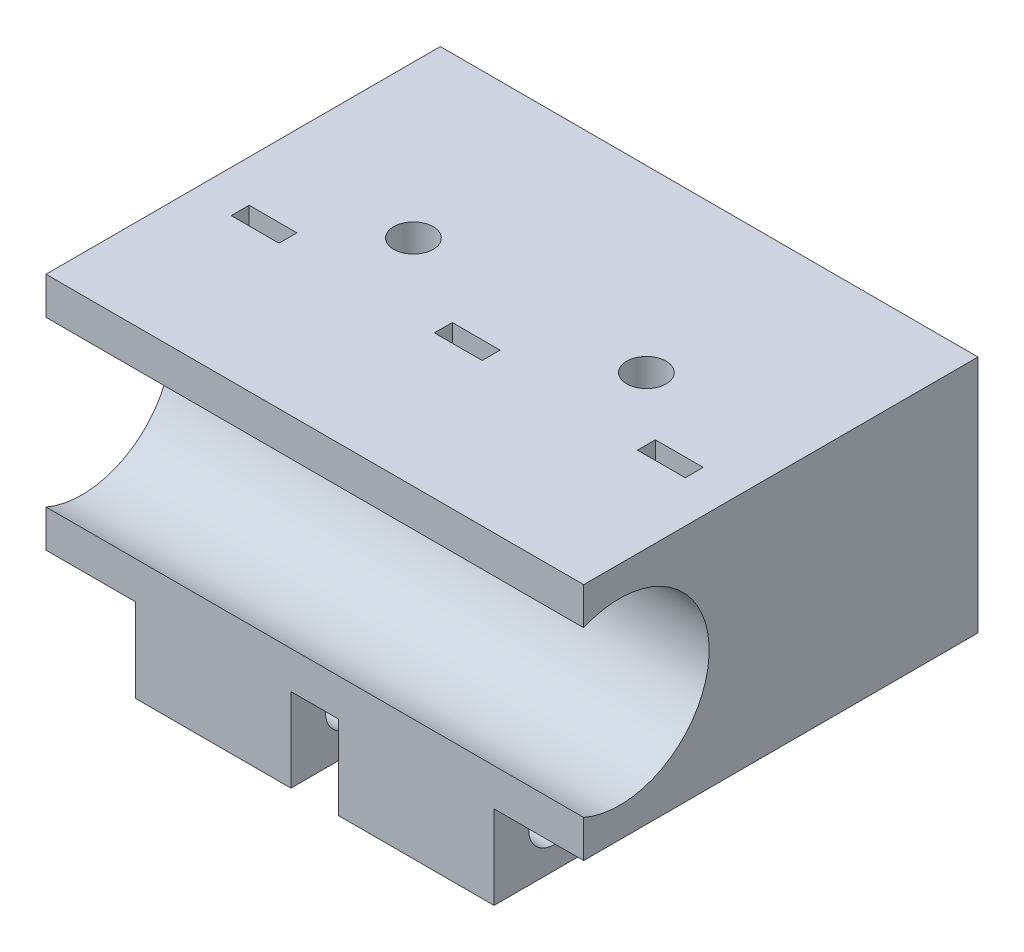
from build123d import *

# Parameters (mm, degrees)
SKETCH2_W             = 45
SKETCH2_H             = 20
BOSS_EXTRUDE1_DEPTH   = 33
SKETCH3_R             = 7.5
CUT_EXTRUDE1_DEPTH    = 45
SKETCH4_R             = 4
CUT_EXTRUDE2_DEPTH    = 10
SKETCH5_W             = 4
SKETCH5_H             = 1.5
CUT_EXTRUDE3_DEPTH    = 39
FILLET1_R             = 9
M4X0_7_TAPPED_HOLE1_D = 3.3
SKETCH8_W             = 13
SKETCH8_H             = 10
BOSS_EXTRUDE2_DEPTH   = 7
SKETCH14_R            = 2.1
CUT_EXTRUDE6_DEPTH    = 53.765992836


with BuildPart() as part:
    # Sketch2 → Boss-Extrude1 (new body)
    with BuildSketch(Plane.XY):
        Rectangle(SKETCH2_W, SKETCH2_H)
    extrude(amount=BOSS_EXTRUDE1_DEPTH)

    # Sketch3 → Cut-Extrude1 (cut)
    with BuildSketch(Plane(origin=(22.5, 0, 0), x_dir=(0, 0, -1), z_dir=(1, 0, 0))):
        with Locations((-30, 0)):
            Circle(SKETCH3_R)
    extrude(amount=-CUT_EXTRUDE1_DEPTH, mode=Mode.SUBTRACT)

    # Sketch4 → Cut-Extrude2 (cut)
    with BuildSketch(Plane(origin=(0, 0, 0), x_dir=(-1, 0, 0), z_dir=(0, 0, -1))):
        with Locations((-15, 0)):
            Circle(SKETCH4_R)
        with Locations((15, 0)):
            Circle(SKETCH4_R)
    extrude(amount=-CUT_EXTRUDE2_DEPTH, mode=Mode.SUBTRACT)

    # Sketch5 → Cut-Extrude3 (cut)
    with BuildSketch(Plane.XZ.offset(10)):
        with Locations((-17, 20.25)):
            Rectangle(SKETCH5_W, SKETCH5_H)
        with Locations((0, 20.25)):
            Rectangle(SKETCH5_W, SKETCH5_H)
        with Locations((17, 20.25)):
            Rectangle(SKETCH5_W, SKETCH5_H)
    extrude(amount=-CUT_EXTRUDE3_DEPTH, mode=Mode.SUBTRACT)

    # Fillet1
    fillet1_edges = [part.edges().sort_by_distance(p)[0] for p in [
        (17, -10, 21),
        (0, -10, 21),
        (-17, -10, 21),
    ]]
    fillet(fillet1_edges, radius=FILLET1_R)

    # M4x0.7 Tapped Hole1 (through all)
    with Locations(Plane(origin=(0, -10, 0), x_dir=(-1, 0, 0), z_dir=(0, -1, 0))):
        with Locations((-9.75, -15), (9.75, -15)):
            Hole(M4X0_7_TAPPED_HOLE1_D / 2)

    # Sketch8 → Boss-Extrude2 (add)
    with BuildSketch(Plane.XZ.offset(10)):
        with Locations((-8.5, 28)):
            Rectangle(SKETCH8_W, SKETCH8_H)
        with Locations((8.5, 28)):
            Rectangle(SKETCH8_W, SKETCH8_H)
    extrude(amount=BOSS_EXTRUDE2_DEPTH)

    # Sketch14 → Cut-Extrude6 (cut, through all)
    with BuildSketch(Plane.ZY.offset(15)):
        with Locations((28, -13)):
            Circle(SKETCH14_R)
    extrude(amount=-CUT_EXTRUDE6_DEPTH, mode=Mode.SUBTRACT)


solid = part.part
